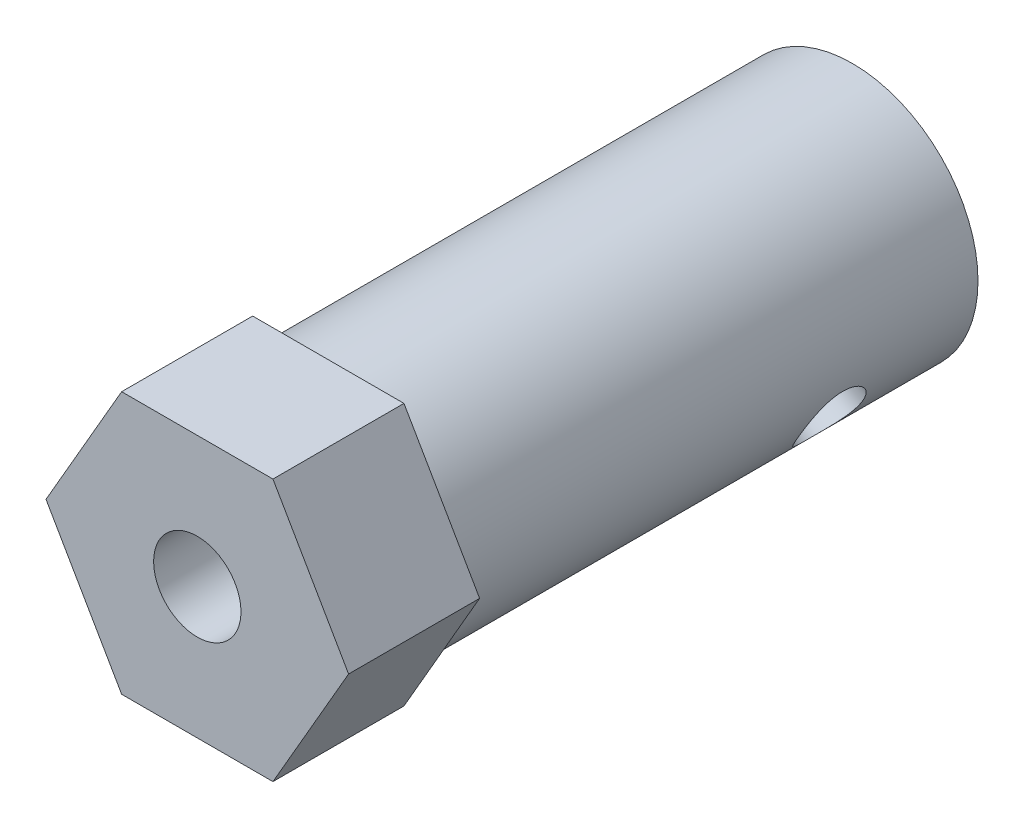
from build123d import *

# Parameters (mm, degrees)
BOSS_EXTRUDE1_DEPTH = 6
SKETCH2_R           = 5.75
BOSS_EXTRUDE2_DEPTH = 24
SKETCH4_R           = 2
CUT_EXTRUDE2_DEPTH  = 32.368774283
SKETCH5_R           = 1.5
CUT_EXTRUDE3_DEPTH  = 6


with BuildPart() as part:
    # Sketch1 → Boss-Extrude1 (new body)
    with BuildSketch(Plane(origin=(0, 0, 0), x_dir=(0, 1, 0), z_dir=(0, 0, 1))):
        Polygon((0, 6.92820323), (-6, 3.464101615), (-6, -3.464101615), (0, -6.92820323), (6, -3.464101615), (6, 3.464101615), align=None)
    extrude(amount=BOSS_EXTRUDE1_DEPTH)

    # Sketch2 → Boss-Extrude2 (add)
    with BuildSketch(Plane(origin=(0, 0, 0), x_dir=(1, 0, 0), z_dir=(0, 0, -1))):
        Circle(SKETCH2_R)
    extrude(amount=BOSS_EXTRUDE2_DEPTH)

    # Sketch4 → Cut-Extrude2 (cut, through all)
    with BuildSketch(Plane(origin=(0, 0, -24), x_dir=(1, 0, 0), z_dir=(0, 0, -1))):
        Circle(SKETCH4_R)
    extrude(amount=-CUT_EXTRUDE2_DEPTH, mode=Mode.SUBTRACT)

    # Sketch5 → Cut-Extrude3 (cut)
    with BuildSketch(Plane(origin=(5.196152423, -3, 0), x_dir=(0.49999999999999506, 0.8660254037844415, 0), z_dir=(0.8660254037844415, -0.49999999999999506, 0))):
        with Locations((0, -18)):
            Circle(SKETCH5_R)
    extrude(amount=-CUT_EXTRUDE3_DEPTH, mode=Mode.SUBTRACT)


solid = part.part
